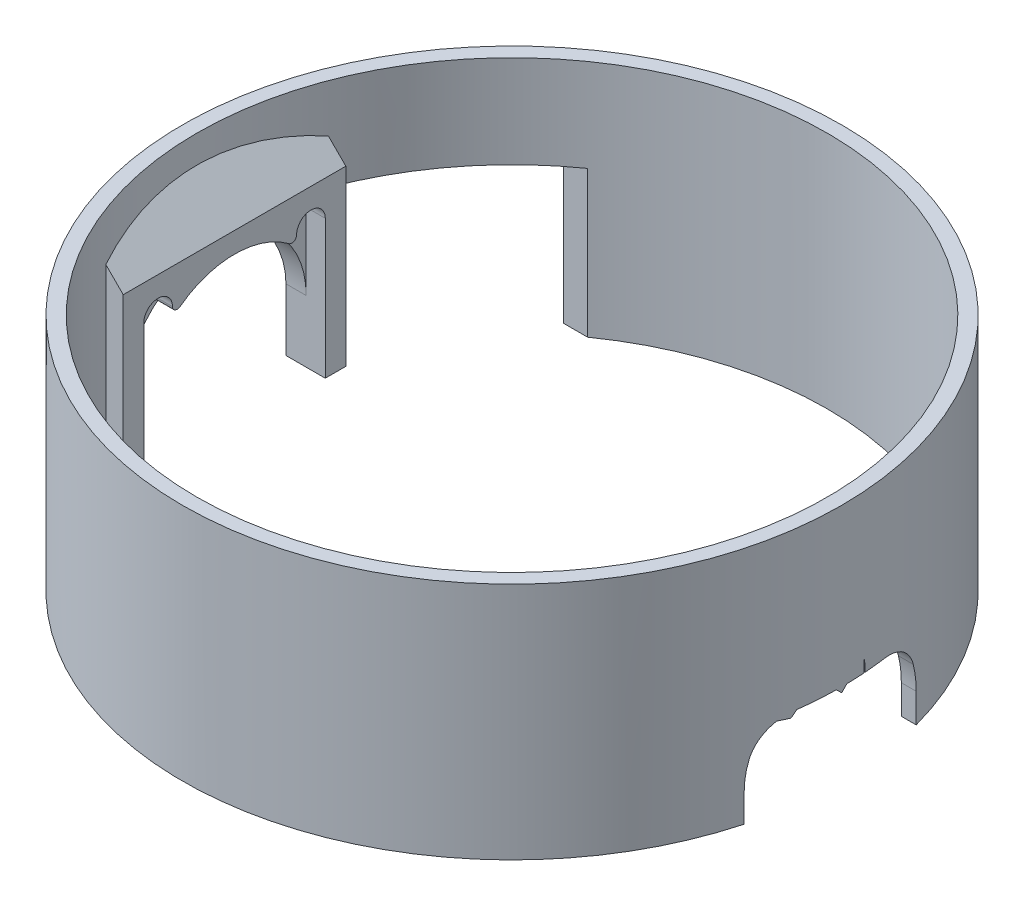
from build123d import *

# Parameters (mm, degrees)
SKETCH1_R                = 69
SKETCH1_R_2              = 66
BOSS_EXTRUDE1_DEPTH      = 50
SKETCH4_W                = 30.6
SKETCH4_H                = 30.6
CUT_EXTRUDE2_DEPTH       = 110.644881321
CUT_EXTRUDE6_DEPTH       = 110.644881321
BOSS_EXTRUDE2_REACH      = 169.745
BOSS_EXTRUDE2_END_RADIUS = 66
BOSS_EXTRUDE2_START      = -58.1
SKETCH8_W                = 46.6
SKETCH8_H                = 35
BOSS_EXTRUDE4_DEPTH      = 30
SKETCH9_OUTSIDE_W        = 206.079
SKETCH9_OUTSIDE_H        = 183.51
SKETCH9_OUTSIDE_R        = 69
CUT_EXTRUDE7_DEPTH       = 126.083349102
CUT_EXTRUDE8_START       = -36.3
CUT_EXTRUDE8_DEPTH       = 33.706349186
CUT_EXTRUDE9_DEPTH       = 110.644881321
CUT_EXTRUDE11_DEPTH      = 4
FILLET3_R                = 1
CUT_EXTRUDE13_START      = 63.498031084
CUT_EXTRUDE13_DEPTH      = 5.501968916


# Read off the part's stored shape, not the designer's step: Cut-Extrude8, Cut-Extrude13
with BuildPart() as part:
    # Sketch1 → Boss-Extrude1 (new body)
    with BuildSketch(Plane(origin=(0, 0, 0), x_dir=(1, 0, 0), z_dir=(0, 1, 0))):
        with Locations(Location((0, 0, 0), (0, 0, 270))):
            Circle(SKETCH1_R)
        with Locations(Location((0, 0, 0), (0, 0, 270))):
            Circle(SKETCH1_R_2, mode=Mode.SUBTRACT)
    extrude(amount=BOSS_EXTRUDE1_DEPTH)

    # Sketch4 → Cut-Extrude2 (cut, through all)
    with BuildSketch(Plane(origin=(0, 0, 0), x_dir=(0, 0, -1), z_dir=(1, 0, 0))):
        with Locations((38.6, 15.3)):
            Rectangle(SKETCH4_W, SKETCH4_H)
    extrude(amount=-CUT_EXTRUDE2_DEPTH, mode=Mode.SUBTRACT)

    # Sketch5 → Cut-Extrude6 (cut, through all)
    with BuildSketch(Plane(origin=(0, 0, 0), x_dir=(0, 0, -1), z_dir=(1, 0, 0))):
        with BuildLine():
            Line((19, 13), (19, -6))
            Line((19, -6), (-19, -6))
            Line((-19, -6), (-19, 13))
            ThreePointArc((-19, 13), (0, 32), (19, 13))
        make_face()
    extrude(amount=-CUT_EXTRUDE6_DEPTH, mode=Mode.SUBTRACT)

    # Boss-Extrude2: up to this cylinder (the profile starts inside it)
    boss_extrude2_end = Plane(origin=(0, 6.5, 0), z_dir=(0, -1, 0)) * Cylinder(BOSS_EXTRUDE2_END_RADIUS, 472.49, mode=Mode.PRIVATE)
    # Sketch6 → Boss-Extrude2 (add, up to the surface)
    with BuildSketch(Plane(origin=(0, 0, 0), x_dir=(0, 0, -1), z_dir=(1, 0, 0)).offset(BOSS_EXTRUDE2_START), mode=Mode.PRIVATE) as boss_extrude2_sk1:
        with BuildLine():
            Line((19, 13), (19, 0))
            Line((19, 0), (23.3, 0))
            Line((23.3, 0), (23.3, 13))
            ThreePointArc((23.3, 13), (0, 36.3), (-23.3, 13))
            Line((-23.3, 13), (-23.3, 0))
            Line((-23.3, 0), (-19, 0))
            Line((-19, 0), (-19, 13))
            ThreePointArc((-19, 13), (0, 32), (19, 13))
        make_face()
    boss_extrude2_tool1 = extrude(boss_extrude2_sk1.sketch, amount=-BOSS_EXTRUDE2_REACH, mode=Mode.PRIVATE) & boss_extrude2_end
    add(boss_extrude2_tool1.solids().sort_by_distance((-58.1, 6.5, 22.709301))[0])

    # Sketch8 → Boss-Extrude4 (add)
    with BuildSketch(Plane(origin=(-10.9, -10.9, 0), x_dir=(0, 0, -1), z_dir=(-0.7071067811865512, -0.7071067811865438, 0))):
        with Locations((0, -66.582903987)):
            Rectangle(SKETCH8_W, SKETCH8_H)
    extrude(amount=BOSS_EXTRUDE4_DEPTH)

    # Sketch9 outside → Cut-Extrude7 (cut, through all)
    with BuildSketch(Plane.XZ):
        with Locations((-11.2845, 0)):
            Rectangle(SKETCH9_OUTSIDE_W, SKETCH9_OUTSIDE_H)
        with Locations(Location((0, 0, 0), (0, 0, 231.366853746))):
            Circle(SKETCH9_OUTSIDE_R, mode=Mode.SUBTRACT)
    extrude(amount=-CUT_EXTRUDE7_DEPTH, mode=Mode.SUBTRACT)

    # Cut-Extrude8 outline → Cut-Extrude8 (cut)
    with BuildSketch(Plane.XZ.offset(CUT_EXTRUDE8_START)):
        with BuildLine():
            Line((-58.1, 23.3), (-58.1, -23.3))
            Line((-58.1, -23.3), (-61.750384614, -23.3))
            ThreePointArc((-61.750384614, -23.3), (66, 0), (-61.750384614, 23.3))
            Line((-61.750384614, 23.3), (-58.1, 23.3))
        make_face()
    extrude(amount=CUT_EXTRUDE8_DEPTH, mode=Mode.SUBTRACT)

    # Sketch5<2> → Cut-Extrude9 (cut, through all)
    with BuildSketch(Plane(origin=(0, 0, 0), x_dir=(0, 0, -1), z_dir=(1, 0, 0))):
        with BuildLine():
            Line((19, 13), (19, -6))
            Line((19, -6), (-19, -6))
            Line((-19, -6), (-19, 13))
            ThreePointArc((-19, 13), (0, 32), (19, 13))
        make_face()
    extrude(amount=-CUT_EXTRUDE9_DEPTH, mode=Mode.SUBTRACT)

    # Sketch11 → Cut-Extrude11 (cut)
    with BuildSketch(Plane(origin=(-58.1, 0, 0), x_dir=(0, 0, -1), z_dir=(1, 0, 0))):
        with BuildLine():
            Line((-19.000000298, 29.000000238), (-19, 11.000000238))
            Line((-19, 11.000000238), (-13.000000298, 11.000000238))
            Line((-13.000000298, 11.000000238), (-13.000000298, 29.000000238))
            ThreePointArc((-13.000000298, 29.000000238), (-16.000000298, 32.000000238), (-19.000000298, 29.000000238))
        make_face()
        with BuildLine():
            Line((12.999999702, 29.000000238), (12.999999702, 11.000000238))
            Line((12.999999702, 11.000000238), (19, 11.000000238))
            Line((19, 11.000000238), (18.999999702, 29.000000238))
            ThreePointArc((18.999999702, 29.000000238), (15.999999702, 32.000000238), (12.999999702, 29.000000238))
        make_face()
    extrude(amount=-CUT_EXTRUDE11_DEPTH, mode=Mode.SUBTRACT)

    # Fillet3
    fillet3_edges = [part.edges().sort_by_distance(p)[0] for p in [
        (-60.1, 26.85640674, -12.999999702),
        (-60.1, 26.856406181, 13.000000298),
    ]]
    fillet(fillet3_edges, radius=FILLET3_R)

    # Cut-Extrude13 outline → Cut-Extrude13 (cut)
    with BuildSketch(Plane(origin=(0, 0, 0), x_dir=(0, 0, -1), z_dir=(1, 0, 0)).offset(CUT_EXTRUDE13_START)):
        with BuildLine():
            ThreePointArc((-12.462948615, 16.54666605), (-15.389142712, 14.557144886), (-17.170905626, 11.50000124))
            ThreePointArc((-17.170905626, 11.50000124), (-17.791519065, 8.831639827), (-18, 6.10000124))
            Line((-18, 6.10000124), (-18, 0))
            Line((-18, 0), (18, 0))
            Line((18, 0), (18, 6.10000124))
            ThreePointArc((18, 6.10000124), (17.791519065, 8.831639827), (17.170905626, 11.50000124))
            ThreePointArc((17.170905626, 11.50000124), (14.272255841, 15.549807439), (9.539392014, 17.10000124))
            Line((9.539392014, 17.10000124), (5.087807935, 17.10000124))
            Line((5.087807935, 17.10000124), (5.002178544, 19.495296139))
            Line((5.002178544, 19.495296139), (4.949747468, 19.547727215))
            Line((4.949747468, 19.547727215), (4.897316393, 19.495296139))
            Line((4.897316393, 19.495296139), (4.811687002, 17.10000124))
            Line((4.811687002, 17.10000124), (1.087807931, 17.10000124))
            Line((1.087807931, 17.10000124), (0, 16.012193309))
            Line((0, 16.012193309), (-1.087807931, 17.10000124))
            Line((-1.087807931, 17.10000124), (-8.811687005, 17.10000124))
            Line((-8.811687005, 17.10000124), (-9.899494937, 16.012193309))
            Line((-9.899494937, 16.012193309), (-12.462948615, 16.54666605))
        make_face()
    extrude(amount=CUT_EXTRUDE13_DEPTH, mode=Mode.SUBTRACT)


solid = part.part
